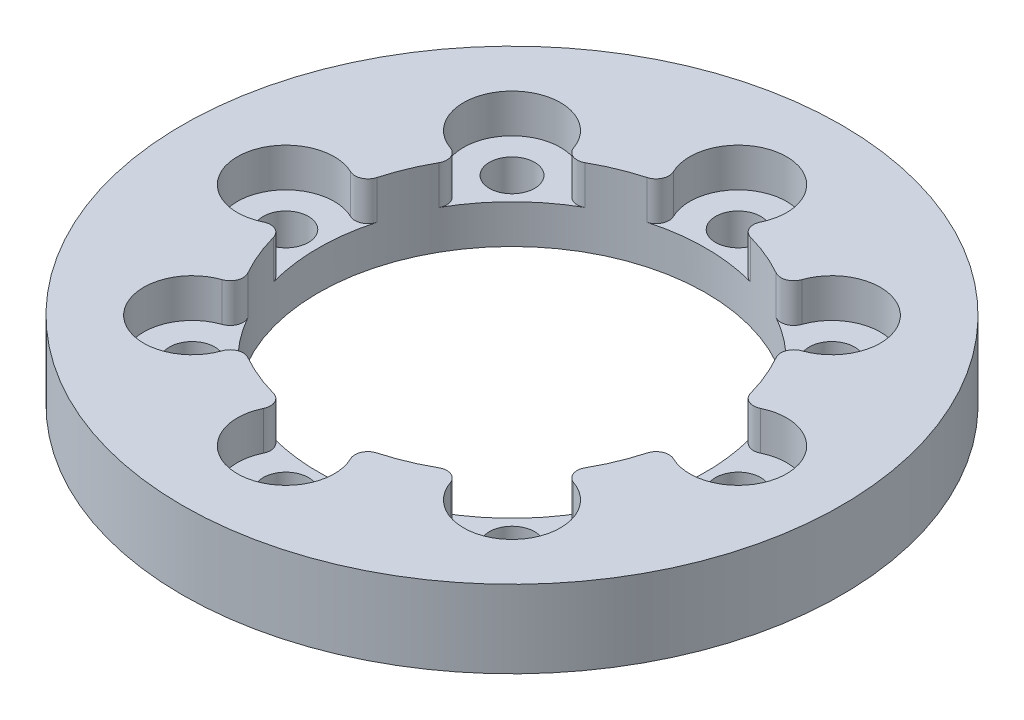
from build123d import *

# Parameters (mm, degrees)
SKETCH1_R           = 25.5
SKETCH1_R_2         = 15
SKETCH1_R_3         = 1.75
BOSS_EXTRUDE1_DEPTH = 6
CUT_EXTRUDE1_START  = -3
SKETCH2_R           = 3.75
SKETCH2_R_2         = 1.75
CUT_EXTRUDE1_DEPTH  = 3
FILLET1_R           = 1


with BuildPart() as part:
    # Sketch1 → Boss-Extrude1 (new body)
    with BuildSketch(Plane(origin=(0, 0, 0), x_dir=(1, 0, 0), z_dir=(0, 1, 0))):
        Circle(SKETCH1_R)
        Circle(SKETCH1_R_2, mode=Mode.SUBTRACT)
        with Locations((0, 17.5)):
            Circle(SKETCH1_R_3, mode=Mode.SUBTRACT)
        with Locations((12.374368671, 12.374368671)):
            Circle(SKETCH1_R_3, mode=Mode.SUBTRACT)
        with Locations((17.5, 0)):
            Circle(SKETCH1_R_3, mode=Mode.SUBTRACT)
        with Locations((12.374368671, -12.374368671)):
            Circle(SKETCH1_R_3, mode=Mode.SUBTRACT)
        with Locations((0, -17.5)):
            Circle(SKETCH1_R_3, mode=Mode.SUBTRACT)
        with Locations((-12.374368671, -12.374368671)):
            Circle(SKETCH1_R_3, mode=Mode.SUBTRACT)
        with Locations((-17.5, 0)):
            Circle(SKETCH1_R_3, mode=Mode.SUBTRACT)
        with Locations((-12.374368671, 12.374368671)):
            Circle(SKETCH1_R_3, mode=Mode.SUBTRACT)
    extrude(amount=BOSS_EXTRUDE1_DEPTH)

    # Sketch2 → Cut-Extrude1 (cut)
    # profile 1 of 8: a face of its own
    with BuildSketch(Plane(origin=(0, 6, 0), x_dir=(1, 0, 0), z_dir=(0, 1, 0)).offset(CUT_EXTRUDE1_START)):
        with Locations((-12.374368671, 12.374368671)):
            Circle(SKETCH2_R)
        with Locations((-12.374368671, 12.374368671)):
            Circle(SKETCH2_R_2, mode=Mode.SUBTRACT)
    # profile 2 of 8: a face of its own
    with BuildSketch(Plane(origin=(0, 6, 0), x_dir=(1, 0, 0), z_dir=(0, 1, 0)).offset(CUT_EXTRUDE1_START)):
        with Locations((-12.374368671, -12.374368671)):
            Circle(SKETCH2_R)
        with Locations((-12.374368671, -12.374368671)):
            Circle(SKETCH2_R_2, mode=Mode.SUBTRACT)
    # profile 3 of 8: a face of its own
    with BuildSketch(Plane(origin=(0, 6, 0), x_dir=(1, 0, 0), z_dir=(0, 1, 0)).offset(CUT_EXTRUDE1_START)):
        with Locations((12.374368671, -12.374368671)):
            Circle(SKETCH2_R)
        with Locations((12.374368671, -12.374368671)):
            Circle(SKETCH2_R_2, mode=Mode.SUBTRACT)
    # profile 4 of 8: a face of its own
    with BuildSketch(Plane(origin=(0, 6, 0), x_dir=(1, 0, 0), z_dir=(0, 1, 0)).offset(CUT_EXTRUDE1_START)):
        with Locations((12.374368671, 12.374368671)):
            Circle(SKETCH2_R)
        with Locations((12.374368671, 12.374368671)):
            Circle(SKETCH2_R_2, mode=Mode.SUBTRACT)
    # profile 5 of 8: a face of its own
    with BuildSketch(Plane(origin=(0, 6, 0), x_dir=(1, 0, 0), z_dir=(0, 1, 0)).offset(CUT_EXTRUDE1_START)):
        with Locations((0, 17.5)):
            Circle(SKETCH2_R)
        with Locations((0, 17.5)):
            Circle(SKETCH2_R_2, mode=Mode.SUBTRACT)
    # profile 6 of 8: a face of its own
    with BuildSketch(Plane(origin=(0, 6, 0), x_dir=(1, 0, 0), z_dir=(0, 1, 0)).offset(CUT_EXTRUDE1_START)):
        with Locations((17.5, 0)):
            Circle(SKETCH2_R)
        with Locations((17.5, 0)):
            Circle(SKETCH2_R_2, mode=Mode.SUBTRACT)
    # profile 7 of 8: a face of its own
    with BuildSketch(Plane(origin=(0, 6, 0), x_dir=(1, 0, 0), z_dir=(0, 1, 0)).offset(CUT_EXTRUDE1_START)):
        with Locations((0, -17.5)):
            Circle(SKETCH2_R)
        with Locations((0, -17.5)):
            Circle(SKETCH2_R_2, mode=Mode.SUBTRACT)
    # profile 8 of 8: a face of its own
    with BuildSketch(Plane(origin=(0, 6, 0), x_dir=(1, 0, 0), z_dir=(0, 1, 0)).offset(CUT_EXTRUDE1_START)):
        with Locations((-17.5, 0)):
            Circle(SKETCH2_R)
        with Locations((-17.5, 0)):
            Circle(SKETCH2_R_2, mode=Mode.SUBTRACT)
    extrude(amount=CUT_EXTRUDE1_DEPTH, mode=Mode.SUBTRACT)

    # Fillet1
    fillet1_edges = [part.edges().sort_by_distance(p)[0] for p in [
        (8.625772794, 4.5, -12.271757971),
        (-14.776785714, 4.5, -2.578100842),
        (-2.578100842, 4.5, -14.776785714),
        (2.578100842, 4.5, -14.776785714),
        (12.271757971, 4.5, -8.625772794),
        (14.776785714, 4.5, -2.578100842),
        (14.776785714, 4.5, 2.578100842),
        (12.271757971, 4.5, 8.625772794),
        (8.625772794, 4.5, 12.271757971),
        (-8.625772794, 4.5, -12.271757971),
        (-12.271757971, 4.5, -8.625772794),
        (2.578100842, 4.5, 14.776785714),
        (-2.578100842, 4.5, 14.776785714),
        (-14.776785714, 4.5, 2.578100842),
        (-8.625772794, 4.5, 12.271757971),
        (-12.271757971, 4.5, 8.625772794),
    ]]
    fillet(fillet1_edges, radius=FILLET1_R)


solid = part.part
